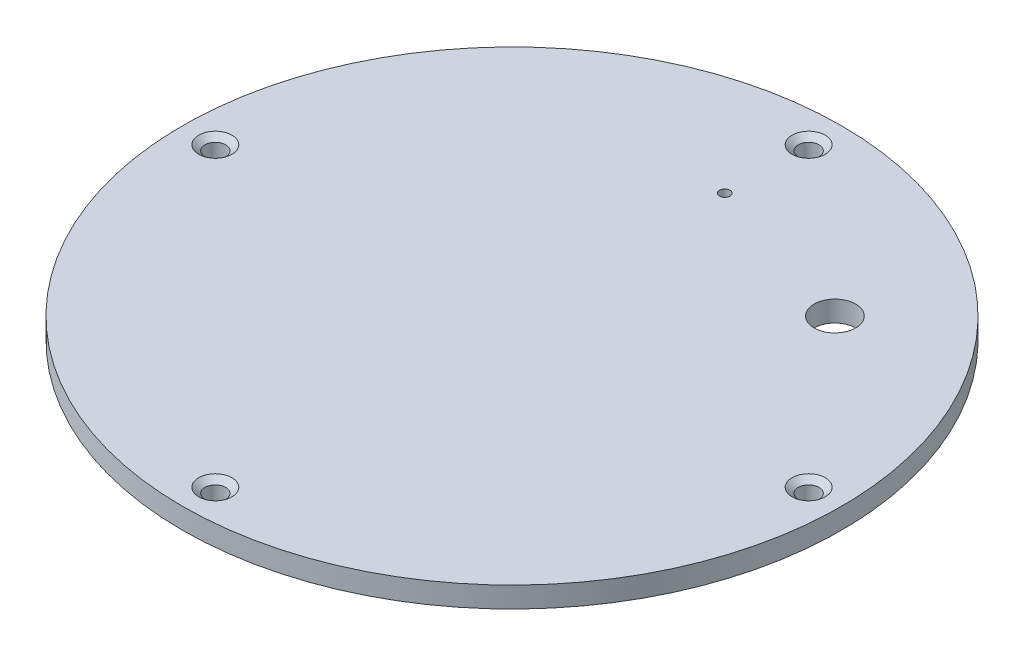
from build123d import *

# Parameters (mm, degrees)
SKETCH1_R                                       = 15.875
BOSS_EXTRUDE1_DEPTH                             = 1
CSK_FOR_M2_FLAT_HEAD_MACHINE_SCREW1_D           = 1
CSK_FOR_M2_FLAT_HEAD_MACHINE_SCREW1_CSINK_D     = 1.6
CSK_FOR_M2_FLAT_HEAD_MACHINE_SCREW1_CSINK_ANGLE = 100
CUT_EXTRUDE1_DEPTH                              = 23.472900347
CUT_EXTRUDE1_DEPTH_BACK                         = 23.472900347
SKETCH5_R                                       = 0.25
SKETCH5_R_2                                     = 1


with BuildPart() as part:
    # Sketch1 → Boss-Extrude1 (new body)
    with BuildSketch(Plane(origin=(0, 0, 0), x_dir=(1, 0, 0), z_dir=(0, 1, 0))):
        Circle(SKETCH1_R)
    extrude(amount=BOSS_EXTRUDE1_DEPTH)

    # CSK for M2 Flat Head Machine Screw1 (through all)
    with Locations(Plane(origin=(0, 1, 0), x_dir=(1, 0, 0), z_dir=(0, 1, 0))):
        with Locations((0, 14.29), (14.29, 0), (0, -14.29), (-14.29, 0)):
            CounterSinkHole(CSK_FOR_M2_FLAT_HEAD_MACHINE_SCREW1_D / 2, CSK_FOR_M2_FLAT_HEAD_MACHINE_SCREW1_CSINK_D / 2, counter_sink_angle=CSK_FOR_M2_FLAT_HEAD_MACHINE_SCREW1_CSINK_ANGLE)

    # Sketch5 → Cut-Extrude1 (cut, two sides: drawn at the far end of the back side and taken through both)
    with BuildSketch(Plane(origin=(0, 1, 0), x_dir=(1, 0, 0), z_dir=(0, 1, 0)).offset(-CUT_EXTRUDE1_DEPTH_BACK)):
        with Locations((0, 10.25)):
            Circle(SKETCH5_R)
        with Locations((7.778174593, 7.778174593)):
            Circle(SKETCH5_R_2)
    extrude(amount=CUT_EXTRUDE1_DEPTH + CUT_EXTRUDE1_DEPTH_BACK, mode=Mode.SUBTRACT)


solid = part.part
